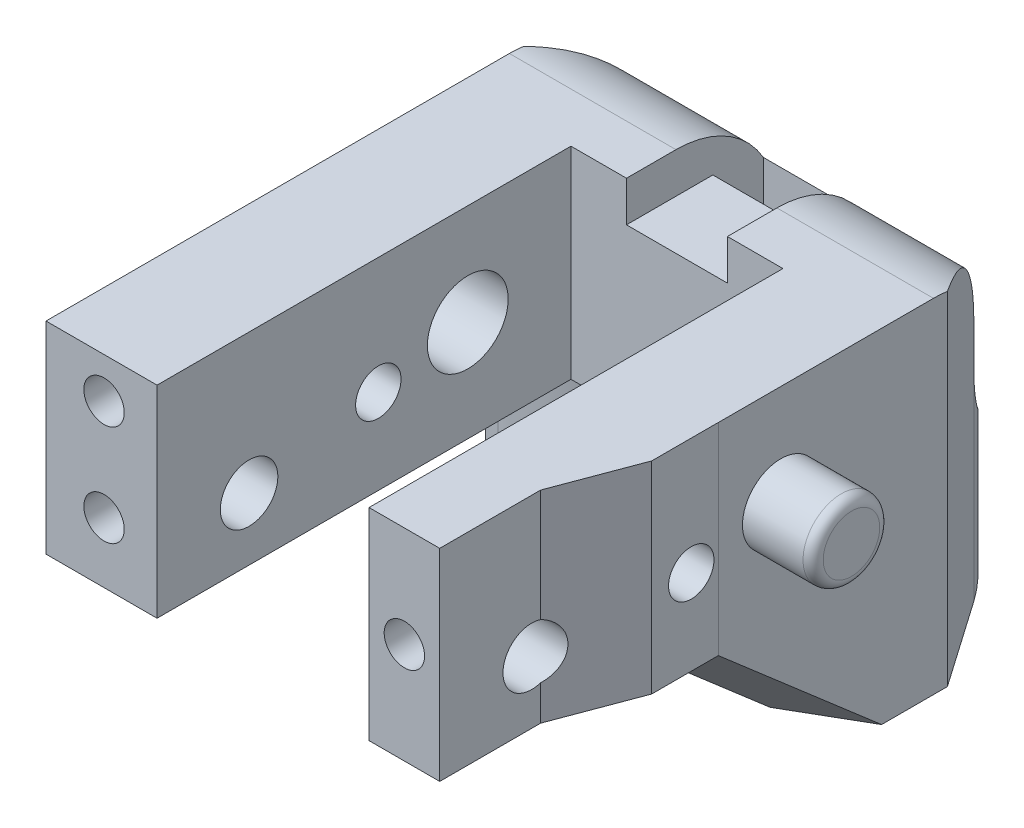
from build123d import *

# Parameters (mm, degrees)
BOSS_EXTRUDE1_DEPTH             = 20
SKETCH6_W                       = 25
SKETCH6_H                       = 20
BOSS_EXTRUDE5_DEPTH             = 5.5
BOSS_EXTRUDE11_START            = -20
BOSS_EXTRUDE11_DEPTH            = 34
SKETCH4_R                       = 2
CUT_EXTRUDE1_DEPTH              = 10
BOSS_EXTRUDE13_DEPTH            = 12
FILLET11_START                  = 14.0499999
FILLET11_DEPTH                  = 7.9500001
FILLET11_START_2                = -14.996842371
FILLET11_2_DEPTH                = 30.996842371
SKETCH22_R                      = 2
CUT_EXTRUDE6_DEPTH              = 10
CHAMFER1_SIZE                   = 14
SKETCH26_W                      = 22
SKETCH26_H                      = 20
BOSS_EXTRUDE14_DEPTH            = 11
CUT_EXTRUDE7_DEPTH              = 2.5
CUT_EXTRUDE8_REACH              = 65.92
SKETCH27_R                      = 4
SKETCH27_R_2                    = 1.15
SKETCH27_R_3                    = 1.6
CUT_EXTRUDE9_DEPTH              = 2.5
BOSS_EXTRUDE15_DEPTH            = 1
BOSS_EXTRUDE15_DEPTH_BACK       = 2
SKETCH31_R                      = 4
SKETCH31_R_2                    = 1.65
SKETCH32_R                      = 2.85
SKETCH32_R_2                    = 2.25
CUT_EXTRUDE12_DEPTH             = 7
CUT_EXTRUDE12_DIRECTION_2_REACH = 61.046
SKETCH33_R                      = 3.8
BOSS_EXTRUDE17_DEPTH            = 7
FILLET17_R                      = 1
CUT_EXTRUDE13_DEPTH             = 14
SKETCH36_R                      = 2
CUT_EXTRUDE14_DEPTH             = 10
FILLET18_R                      = 10
CUT_EXTRUDE16_REACH             = 67.49
SKETCH37_W                      = 5.717933373
SKETCH37_H                      = 6
CHAMFER2_SIZE                   = 7
SKETCH38_W                      = 10
SKETCH38_H                      = 20
CUT_EXTRUDE17_DEPTH             = 4
CUT_EXTRUDE19_REACH             = 59.527
SKETCH39_W                      = 10
SKETCH39_H                      = 5
CUT_EXTRUDE20_DEPTH             = 83.61561247
CUT_EXTRUDE20_DEPTH_BACK        = 83.61561247
SKETCH40_W                      = 71.015717368
SKETCH40_H                      = 42.367018064


with BuildPart() as part:
    # Sketch1 → Boss-Extrude1 (new body)
    with BuildSketch(Plane(origin=(0, 0, 0), x_dir=(1, 0, 0), z_dir=(0, 1, 0))):
        Polygon((-15.5, -37), (-10, -37), (-10, 4), (11, 4), (11, -37), (18, -37), (18, -27), (21, -19), (21, 10), (-15.5, 10), align=None)
    extrude(amount=BOSS_EXTRUDE1_DEPTH)

    # Sketch6 → Boss-Extrude5 (add)
    with BuildSketch(Plane.ZY.offset(15.5)):
        with Locations((2.5, 10)):
            Rectangle(SKETCH6_W, SKETCH6_H)
    extrude(amount=BOSS_EXTRUDE5_DEPTH)

    # Sketch20 → Boss-Extrude11 (add)
    with BuildSketch(Plane(origin=(0, 20, 0), x_dir=(1, 0, 0), z_dir=(0, 1, 0)).offset(BOSS_EXTRUDE11_START)):
        Polygon((-21, 6.554166441), (14, 6.554166441), (14, -16.445833559), (21.006315459, -12.400735443), (21.006315459, 10.282066627), (15.003157729, 18.901571597), (-14.996842271, 18.901571597), (-21, 10.282066627), align=None)
    extrude(amount=BOSS_EXTRUDE11_DEPTH)

    # Sketch4 → Cut-Extrude1 (cut)
    with BuildSketch(Plane(origin=(0, 20, 0), x_dir=(1, 0, 0), z_dir=(0, 1, 0))):
        with Locations(Location((-4.375, 8, 0), (0, 0, 270))):
            Circle(SKETCH4_R)
        with Locations(Location((5.375, 8, 0), (0, 0, 270))):
            Circle(SKETCH4_R)
    extrude(amount=-CUT_EXTRUDE1_DEPTH, mode=Mode.SUBTRACT)

    # Sketch24 → Boss-Extrude13 (add)
    with BuildSketch(Plane(origin=(0, 34, 0), x_dir=(1, 0, 0), z_dir=(0, 1, 0))):
        with BuildLine():
            Line((-14.996842271, 18.901571597), (-14.420936492, 19.728473528))
            ThreePointArc((-14.420936492, 19.728473528), (-3.81756267, 26.467738085), (8.613124034, 24.643662635))
            ThreePointArc((8.613124034, 24.643662635), (12.140366622, 22.142331504), (15.003157729, 18.901571597))
            Line((15.003157729, 18.901571597), (21.006315459, 10.282066627))
            Line((21.006315459, 10.282066627), (21.006315459, 6.554166441))
            Line((21.006315459, 6.554166441), (-21, 6.554166441))
            Line((-21, 6.554166441), (-21, 10.282066627))
            Line((-21, 10.282066627), (-14.996842271, 18.901571597))
        make_face()
    extrude(amount=-BOSS_EXTRUDE13_DEPTH)

    # Fillet11: read off the stored shape, not the designer's step
    # Fillet11 outline → Fillet11 (add)
    with BuildSketch(Plane(origin=(0, 0, 0), x_dir=(1, 0, 0), z_dir=(0, 1, 0)).offset(FILLET11_START)):
        with BuildLine():
            Line((-14.996842271, 18.901571597), (15.003161757, 18.901565813))
            ThreePointArc((15.003161757, 18.901565813), (12.140369243, 22.142329149), (8.613124034, 24.643662635))
            ThreePointArc((8.613124034, 24.643662635), (-3.81756267, 26.467738085), (-14.420936492, 19.728473528))
            Line((-14.420936492, 19.728473528), (-14.996842271, 18.901571597))
        make_face()
    extrude(amount=FILLET11_DEPTH)

    # Fillet11 2 outline → Fillet11 2 (cut)
    with BuildSketch(Plane.YZ.offset(FILLET11_START_2)):
        with BuildLine():
            Line((22, -28), (22, -26.851571597))
            ThreePointArc((22, -26.851571597), (19.67149891, -21.230072687), (14.05, -18.901571597))
            Line((14.05, -18.901571597), (14.0499999, -28))
            Line((14.0499999, -28), (22, -28))
        make_face()
    extrude(amount=FILLET11_2_DEPTH, mode=Mode.SUBTRACT)

    # Sketch22 → Cut-Extrude6 (cut)
    with BuildSketch(Plane(origin=(0, 34, 0), x_dir=(1, 0, 0), z_dir=(0, 1, 0))):
        with Locations(Location((-14.720302421, 13.351367671, 0), (0, 0, 270))):
            Circle(SKETCH22_R)
        with Locations(Location((-3.067324575, 22.581252689, 0), (0, 0, 270))):
            Circle(SKETCH22_R)
    extrude(amount=-CUT_EXTRUDE6_DEPTH, mode=Mode.SUBTRACT)

    # Chamfer1
    chamfer1_edges = [part.edges().sort_by_distance(p)[0] for p in [
        (17.503157729, 34, 14.423284501),
    ]]
    chamfer(chamfer1_edges, length=CHAMFER1_SIZE)

    # Sketch26 → Boss-Extrude14 (add)
    with BuildSketch(Plane.ZY.offset(21)):
        with Locations((26, 10)):
            Rectangle(SKETCH26_W, SKETCH26_H)
    extrude(amount=-BOSS_EXTRUDE14_DEPTH)

    # Sketch25 → Cut-Extrude7 (cut)
    with BuildSketch(Plane.ZY.offset(21)):
        with BuildLine():
            Line((11.868890963, 14.931194411), (31.150048263, 18.330982662))
            ThreePointArc((31.150048263, 18.330982662), (35.639064994, 15.187739308), (32.49582164, 10.698722576))
            Line((32.49582164, 10.698722576), (13.21466434, 7.298934325))
            ThreePointArc((13.21466434, 7.298934325), (-1.168124774, 8.697638667), (11.868890963, 14.931194411))
        make_face()
    extrude(amount=-CUT_EXTRUDE7_DEPTH, mode=Mode.SUBTRACT)

    # Sketch27 → Cut-Extrude8 (cut, up to next)
    with BuildSketch(Plane.ZY.offset(18.5), mode=Mode.PRIVATE) as cut_extrude8_sk1:
        with Locations((6.217933373, 10)):
            Circle(SKETCH27_R)
    cut_extrude8_tool1 = extrude(cut_extrude8_sk1.sketch, amount=-CUT_EXTRUDE8_REACH, mode=Mode.PRIVATE) & part.part
    # Sketch27 → Cut-Extrude8 (cut, up to next)
    with BuildSketch(Plane.ZY.offset(18.5), mode=Mode.PRIVATE) as cut_extrude8_sk2:
        with Locations((15.08120315, 11.562833599)):
            Circle(SKETCH27_R_2)
    cut_extrude8_tool2 = extrude(cut_extrude8_sk2.sketch, amount=-CUT_EXTRUDE8_REACH, mode=Mode.PRIVATE) & part.part
    # Sketch27 → Cut-Extrude8 (cut, up to next)
    with BuildSketch(Plane.ZY.offset(18.5), mode=Mode.PRIVATE) as cut_extrude8_sk3:
        with Locations((27.883703939, 13.820259909)):
            Circle(SKETCH27_R_3)
    cut_extrude8_tool3 = extrude(cut_extrude8_sk3.sketch, amount=-CUT_EXTRUDE8_REACH, mode=Mode.PRIVATE) & part.part
    add(cut_extrude8_tool1.solids().sort_by_distance((-18.5, 10, 6.217933))[0], mode=Mode.SUBTRACT)
    add(cut_extrude8_tool2.solids().sort_by_distance((-18.5, 11.562834, 15.081203))[0], mode=Mode.SUBTRACT)
    add(cut_extrude8_tool3.solids().sort_by_distance((-18.5, 13.82026, 27.883704))[0], mode=Mode.SUBTRACT)

    # Sketch28 → Cut-Extrude9 (cut)
    with BuildSketch(Plane.ZY.offset(21)):
        Polygon((-0.028318142, 0.777915528), (-3.197748963, 15.950413947), (10.506443157, 18.813125656), (17.248705835, 15.879800924), (18.680061689, 9.027704864), (13.675873978, 3.640627238), align=None)
    extrude(amount=-CUT_EXTRUDE9_DEPTH, mode=Mode.SUBTRACT)

    # Sketch31 → Boss-Extrude15 (add, two sides: drawn at the far end of the back side and taken through both)
    with BuildSketch(Plane.ZY.offset(18.5).offset(-BOSS_EXTRUDE15_DEPTH_BACK)):
        with Locations((6.217933373, 10)):
            Circle(SKETCH31_R)
        with Locations((6.217933373, 10)):
            Circle(SKETCH31_R_2, mode=Mode.SUBTRACT)
    extrude(amount=BOSS_EXTRUDE15_DEPTH + BOSS_EXTRUDE15_DEPTH_BACK)

    # Sketch32 → Cut-Extrude12 (cut)
    with BuildSketch(Plane(origin=(-10, 0, 0), x_dir=(0, 0, -1), z_dir=(1, 0, 0))):
        with Locations((-27.883703939, 13.820259909)):
            Circle(SKETCH32_R)
        with Locations((-15.08120315, 11.562833599)):
            Circle(SKETCH32_R_2)
    extrude(amount=-CUT_EXTRUDE12_DEPTH, mode=Mode.SUBTRACT)

    # Sketch32 → Cut-Extrude12 direction 2 (cut, up to next)
    with BuildSketch(Plane(origin=(-10, 0, 0), x_dir=(0, 0, -1), z_dir=(1, 0, 0)), mode=Mode.PRIVATE) as cut_extrude12_direction_2_sk1:
        with Locations((-27.883703939, 13.820259909)):
            Circle(SKETCH32_R)
    cut_extrude12_direction_2_tool1 = extrude(cut_extrude12_direction_2_sk1.sketch, amount=CUT_EXTRUDE12_DIRECTION_2_REACH, mode=Mode.PRIVATE) & part.part
    # Sketch32 → Cut-Extrude12 direction 2 (cut, up to next)
    with BuildSketch(Plane(origin=(-10, 0, 0), x_dir=(0, 0, -1), z_dir=(1, 0, 0)), mode=Mode.PRIVATE) as cut_extrude12_direction_2_sk2:
        with Locations((-15.08120315, 11.562833599)):
            Circle(SKETCH32_R_2)
    cut_extrude12_direction_2_tool2 = extrude(cut_extrude12_direction_2_sk2.sketch, amount=CUT_EXTRUDE12_DIRECTION_2_REACH, mode=Mode.PRIVATE) & part.part
    add(cut_extrude12_direction_2_tool1.solids().sort_by_distance((-10, 13.82026, 27.883704))[0], mode=Mode.SUBTRACT)
    add(cut_extrude12_direction_2_tool2.solids().sort_by_distance((-10, 11.562834, 15.081203))[0], mode=Mode.SUBTRACT)

    # Sketch33 → Boss-Extrude17 (add)
    with BuildSketch(Plane(origin=(21.006315459, 0, 0), x_dir=(0, 0, -1), z_dir=(1, 0, 0))):
        with Locations((-6.217933373, 10)):
            Circle(SKETCH33_R)
    extrude(amount=BOSS_EXTRUDE17_DEPTH)

    # Fillet17
    fillet17_edges = [part.edges().sort_by_distance(p)[0] for p in [
        (28.006315459, 10, 10.017933373),
    ]]
    fillet(fillet17_edges, radius=FILLET17_R)

    # Sketch35 → Cut-Extrude13 (cut)
    with BuildSketch(Plane(origin=(0, 34, 0), x_dir=(1, 0, 0), z_dir=(0, 1, 0))):
        with BuildLine():
            Line((-19.79995418, 6.554166441), (14, 6.554166441))
            Line((14, 6.554166441), (14, 12.554166441))
            Line((14, 12.554166441), (-9.802737675, 12.554166441))
            ThreePointArc((-9.802737675, 12.554166441), (-11.071315957, 11.28171537), (-12.284990593, 9.956794065))
            ThreePointArc((-12.284990593, 9.956794065), (-15.675255632, 7.444453939), (-19.79995418, 6.554166441))
        make_face()
    extrude(amount=-CUT_EXTRUDE13_DEPTH, mode=Mode.SUBTRACT)

    # Sketch36 → Cut-Extrude14 (cut)
    with BuildSketch(Plane.XY.offset(37)):
        with Locations((-15.25, 14)):
            Circle(SKETCH36_R)
        with Locations((14.5, 10)):
            Circle(SKETCH36_R)
        with Locations((-15.25, 4)):
            Circle(SKETCH36_R)
    extrude(amount=-CUT_EXTRUDE14_DEPTH, mode=Mode.SUBTRACT)

    # Fillet18
    fillet18_edges = [part.edges().sort_by_distance(p)[0] for p in [
        (0.003157729, 0, -18.901571597),
    ]]
    fillet(fillet18_edges, radius=FILLET18_R)

    # Sketch37 → Cut-Extrude16 (cut, up to next)
    with BuildSketch(Plane(origin=(21, 0, 0), x_dir=(0, 0, -1), z_dir=(1, 0, 0)), mode=Mode.PRIVATE) as cut_extrude16_sk1:
        with Locations((1.141033313, 10)):
            Rectangle(SKETCH37_W, SKETCH37_H)
    cut_extrude16_tool1 = extrude(cut_extrude16_sk1.sketch, amount=-CUT_EXTRUDE16_REACH, mode=Mode.PRIVATE) & part.part
    add(cut_extrude16_tool1.solids().sort_by_distance((21, 10, -1.141033))[0], mode=Mode.SUBTRACT)

    # Chamfer2
    chamfer2_edges = [part.edges().sort_by_distance(p)[0] for p in [
        (11, 10, 1.717933373),
    ]]
    chamfer(chamfer2_edges, length=CHAMFER2_SIZE)

    # Sketch38 → Cut-Extrude17 (cut)
    with BuildSketch(Plane.XZ):
        with Locations((0.5, -14)):
            Rectangle(SKETCH38_W, SKETCH38_H)
    extrude(amount=-CUT_EXTRUDE17_DEPTH, mode=Mode.SUBTRACT)

    # Sketch39 → Cut-Extrude19 (cut, up to next)
    with BuildSketch(Plane(origin=(0, 34, 0), x_dir=(1, 0, 0), z_dir=(0, 1, 0)), mode=Mode.PRIVATE) as cut_extrude19_sk1:
        with Locations((0.5, 15.054166441)):
            Rectangle(SKETCH39_W, SKETCH39_H)
    cut_extrude19_tool1 = extrude(cut_extrude19_sk1.sketch, amount=-CUT_EXTRUDE19_REACH, mode=Mode.PRIVATE) & part.part
    add(cut_extrude19_tool1.solids().sort_by_distance((0.5, 34, -15.054166))[0], mode=Mode.SUBTRACT)


with BuildPart() as body_2:
    # Mirror1: mirrored copy
    add(part.part.mirror(Plane(origin=(0, -10, 0), x_dir=(0, 0, 1), z_dir=(0, -1, 0))))


with BuildPart() as part_1:
    add(part.part)

    # Sketch40 → Cut-Extrude20 (cut, two sides: drawn at the far end of the back side and taken through both)
    with BuildSketch(Plane(origin=(0, 0, -18.901571597), x_dir=(-1, 0, 0), z_dir=(0, 0, -1)).offset(-CUT_EXTRUDE20_DEPTH_BACK)):
        with Locations((-4.991813068, 18.312991293)):
            Rectangle(SKETCH40_W, SKETCH40_H)
    extrude(amount=CUT_EXTRUDE20_DEPTH + CUT_EXTRUDE20_DEPTH_BACK, mode=Mode.SUBTRACT)


solid = body_2.part
